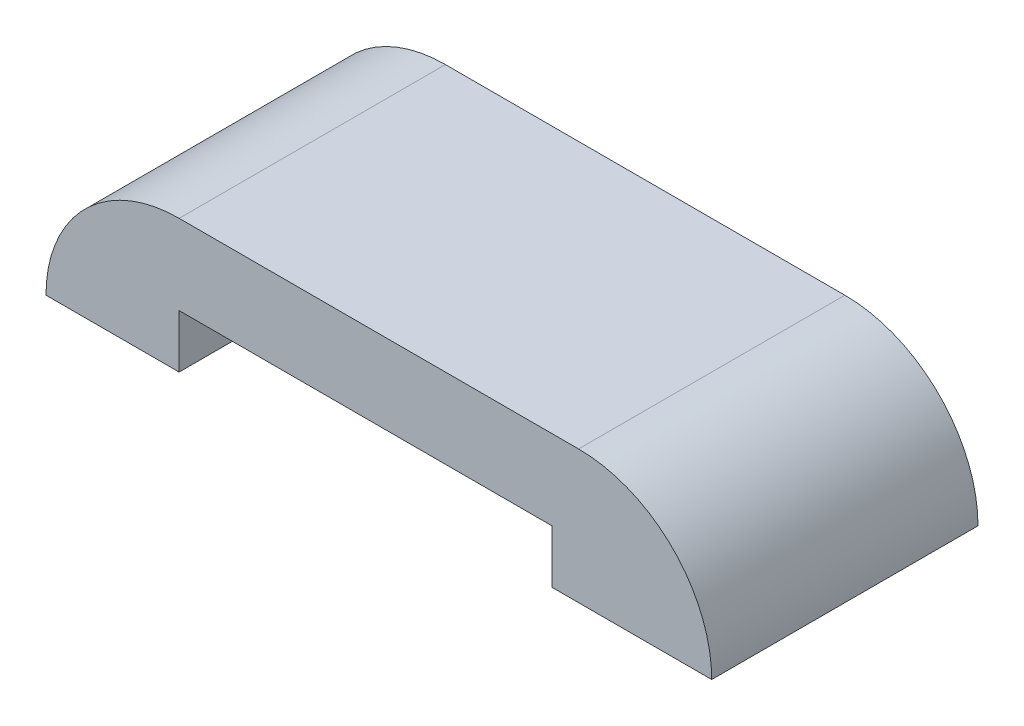
from build123d import *

# Parameters (mm, degrees)
BOSS_EXTRUDE1_DEPTH = 10
FILLET2_R           = 5
FILLET3_R           = 5


with BuildPart() as part:
    # Sketch1 → Boss-Extrude1 (new body)
    with BuildSketch(Plane.XY):
        Polygon((0, 0), (0, 5), (25, 5), (25, 0), (19, 0), (19, 2), (5, 2), (5, 0), align=None)
    extrude(amount=BOSS_EXTRUDE1_DEPTH)

    # Fillet2
    fillet2_edges = [part.edges().sort_by_distance(p)[0] for p in [
        (0, 5, 5),
    ]]
    fillet(fillet2_edges, radius=FILLET2_R - 0.0001)  # a hair under: the kernel refuses the full size

    # Fillet3
    fillet3_edges = [part.edges().sort_by_distance(p)[0] for p in [
        (25, 5, 5),
    ]]
    fillet(fillet3_edges, radius=FILLET3_R - 0.0001)  # a hair under: the kernel refuses the full size


solid = part.part
